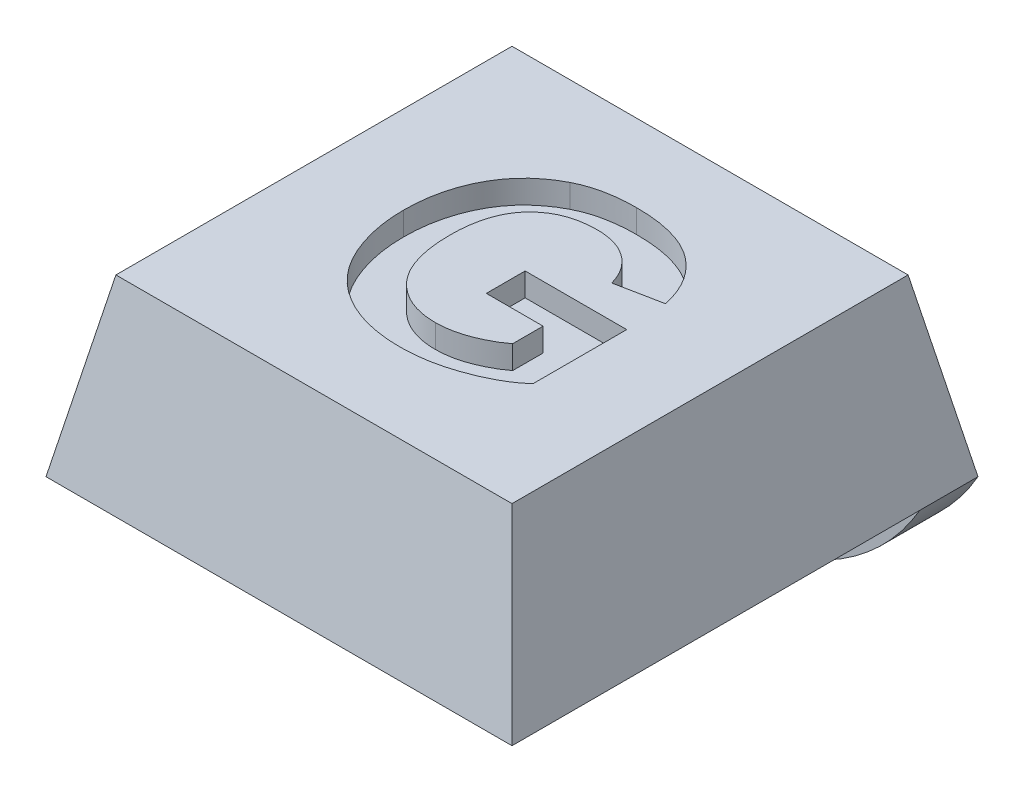
from build123d import *

# Parameters (mm, degrees)
SKETCH1_W               = 8
SKETCH1_H               = 8
BOSS_EXTRUDE1_DEPTH     = 3
CUT_EXTRUDE1_DEPTH      = 12.704699911
CUT_EXTRUDE1_DEPTH_BACK = 12.704699911
CUT_EXTRUDE2_DEPTH      = 11
SKETCH4_R               = 1.8
CUT_EXTRUDE3_DEPTH      = 0.8
SKETCH5_W               = 8
SKETCH5_H               = 1
BOSS_EXTRUDE2_DEPTH     = 2
FILLET1_R               = 4
CUT_EXTRUDE4_DEPTH      = 0.4


with BuildPart() as part:
    # Sketch1 → Boss-Extrude1 (new body)
    with BuildSketch(Plane(origin=(0, 0, 0), x_dir=(1, 0, 0), z_dir=(0, 1, 0))):
        with Locations((4, 4)):
            Rectangle(SKETCH1_W, SKETCH1_H)
    extrude(amount=BOSS_EXTRUDE1_DEPTH)

    # Sketch2 → Cut-Extrude1 (cut, two sides: drawn at the far end of the back side and taken through both)
    with BuildSketch(Plane.XY.offset(-CUT_EXTRUDE1_DEPTH_BACK)):
        Polygon((0, 0), (0.6, 3), (0, 3), align=None)
        Polygon((8, 0), (7.4, 3), (8, 3), align=None)
    extrude(amount=CUT_EXTRUDE1_DEPTH + CUT_EXTRUDE1_DEPTH_BACK, mode=Mode.SUBTRACT)

    # Sketch3 → Cut-Extrude2 (cut)
    with BuildSketch(Plane(origin=(0, 0, 0), x_dir=(0, 0, -1), z_dir=(1, 0, 0))):
        Polygon((0, 0), (0.6, 3), (0, 3), align=None)
        Polygon((8, 3), (7.4, 3), (8, 0), align=None)
    extrude(amount=CUT_EXTRUDE2_DEPTH, mode=Mode.SUBTRACT)

    # Sketch4 → Cut-Extrude3 (cut)
    with BuildSketch(Plane.XZ):
        with Locations(Location((4, -3.75, 0), (0, 0, 270))):
            Circle(SKETCH4_R)
    extrude(amount=-CUT_EXTRUDE3_DEPTH, mode=Mode.SUBTRACT)

    # Sketch5 → Boss-Extrude2 (add)
    with BuildSketch(Plane.XZ):
        with Locations((4, -7.5)):
            Rectangle(SKETCH5_W, SKETCH5_H)
    extrude(amount=BOSS_EXTRUDE2_DEPTH)

    # Fillet1
    # the kernel refuses this fillet: 4 mm, written as the material it takes off along each edge
    with BuildSketch(Plane(origin=(8, -2, -16.660254038), x_dir=(0, 1, 0), z_dir=(0, 0, 1)), Plane(origin=(0, -2, 1.660254038), x_dir=(0, 1, 0), z_dir=(0, 0, -1))) as fillet1_piece_1:
        with BuildLine():
            CenterArc((4, 3.464101615), FILLET1_R, 180, 60)
            Line((0, 3.464101615), (-0.08, 3.464101615))
            Line((-0.08, 3.464101615), (-0.08, 0))
            Line((-0.08, 0), (0, -0.08))
            ThreePointArc((0, -0.08), (1, -0.08), (1.96, -0.069282032))
            Line((1.96, -0.069282032), (2, 0))
        make_face()
    extrude(amount=18.320508076, mode=Mode.SUBTRACT)

    # Sketch6 → Cut-Extrude4 (cut)
    with BuildSketch(Plane(origin=(0, 3, 0), x_dir=(1, 0, 0), z_dir=(0, 1, 0))):
        with BuildLine():
            Line((4.053794593, 3.505457585), (4.053794593, 4.172124252))
            Line((4.053794593, 4.172124252), (5.797384337, 4.172124252))
            Line((5.797384337, 4.172124252), (5.797384337, 2.564752457))
            add(Edge.make_bspline(
                [(5.797384337, 2.564752457), (5.775440275, 2.544992361), (5.730582172, 2.504598726), (5.657391115, 2.447633596), (5.576814656, 2.393249062), (5.489339896, 2.340343698), (5.394785806, 2.289343315), (5.293529517, 2.239537607), (5.185384208, 2.19141366), (5.032450931, 2.131128575), (4.835594452, 2.065533422), (4.594933471, 2.008496304), (4.352368706, 1.973513189), (4.190125473, 1.969167013), (4.109083055, 1.966996047)],
                knots=[0, 0, 0, 0, 0.581799769, 1.189316438, 1.825828404, 2.496525428, 3.203088405, 3.942228803, 4.719818701, 5.534979611, 7.181138583, 8.803804008, 10.403462225, 12, 12, 12, 12], degree=3))
            add(Edge.make_bspline(
                [(4.109083055, 1.966996047), (4.058312627, 1.967758979), (3.958229013, 1.969262944), (3.810482794, 1.981368296), (3.667847904, 2.002080495), (3.530208107, 2.031409962), (3.397097502, 2.066765974), (3.26907094, 2.111868039), (3.146582956, 2.166009466), (3.028523806, 2.226338905), (2.917094396, 2.295632176), (2.812187083, 2.371432832), (2.714561168, 2.454400196), (2.624566637, 2.544701507), (2.540998329, 2.641714843), (2.464831298, 2.745902822), (2.396526155, 2.857385727), (2.335239765, 2.974765127), (2.280716867, 3.097008702), (2.234709094, 3.223154334), (2.194374003, 3.351370526), (2.161222966, 3.482107416), (2.136875151, 3.615790052), (2.117947657, 3.751799892), (2.107781758, 3.890986734), (2.105984472, 3.984609884), (2.105076645, 4.031899893)],
                knots=[0, 0, 0, 0, 1.124918047, 2.217548049, 3.282233239, 4.316494221, 5.334437038, 6.332151046, 7.320712088, 8.300141923, 9.267552434, 10.225301062, 11.165776911, 12.103230934, 13.047553934, 14.000517593, 14.959782875, 15.941944936, 16.932894943, 17.923491392, 18.915624898, 19.910402922, 20.909870877, 21.92519501, 22.95199481, 24, 24, 24, 24], degree=3))
            add(Edge.make_bspline(
                [(2.105076645, 4.031899893), (2.105812881, 4.082940857), (2.107264322, 4.183564655), (2.119773705, 4.33228546), (2.139199297, 4.476648194), (2.168656936, 4.616390773), (2.20449512, 4.75216369), (2.248233589, 4.883877531), (2.301822866, 5.010556427), (2.361436063, 5.133283761), (2.429297714, 5.250362339), (2.505977563, 5.360290437), (2.589206445, 5.464176802), (2.680629029, 5.560371285), (2.779923369, 5.648827012), (2.886080088, 5.730522243), (2.998844963, 5.806865303), (3.079553832, 5.849911113), (3.120301004, 5.871643482)],
                knots=[0, 0, 0, 0, 1.105010302, 2.178452875, 3.229459892, 4.257086284, 5.268538906, 6.268935615, 7.259234261, 8.24469117, 9.221745683, 10.185929258, 11.144249683, 12.101504986, 13.055838221, 14.020611351, 15.000673771, 16, 16, 16, 16], degree=3))
            add(Edge.make_bspline(
                [(3.120301004, 5.871643482), (3.152638085, 5.887700047), (3.218317351, 5.920312247), (3.322813337, 5.959248923), (3.432101667, 5.994677516), (3.547832356, 6.021111591), (3.6692195, 6.042829226), (3.796209305, 6.059036287), (3.929210312, 6.067547239), (4.019595582, 6.068879104), (4.065813824, 6.069560149)],
                knots=[0, 0, 0, 0, 0.887969848, 1.803539625, 2.741143579, 3.713741423, 4.722068772, 5.775476617, 6.8624965, 8, 8, 8, 8], degree=3))
            add(Edge.make_bspline(
                [(4.065813824, 6.069560149), (4.125403824, 6.06867255), (4.241295356, 6.066946335), (4.410256532, 6.05256252), (4.569271079, 6.027772487), (4.718560435, 5.993629866), (4.857802985, 5.949731518), (4.986759025, 5.895763799), (5.106220057, 5.832812796), (5.214455834, 5.758355608), (5.313666102, 5.676257846), (5.403591975, 5.586419647), (5.48426965, 5.488707943), (5.555752499, 5.383614392), (5.617477906, 5.2707046), (5.670549966, 5.151008328), (5.714234697, 5.023616882), (5.73534656, 4.935145779), (5.746102286, 4.89007297)],
                knots=[0, 0, 0, 0, 1.271135529, 2.472123572, 3.614091059, 4.701890498, 5.736279567, 6.724681829, 7.680621489, 8.611506429, 9.52200816, 10.424540711, 11.318996785, 12.221421405, 13.131851814, 14.060431888, 15.011860567, 16, 16, 16, 16], degree=3))
            Line((5.746102286, 4.89007297), (4.976871517, 4.736226816))
            add(Edge.make_bspline(
                [(4.976871517, 4.736226816), (4.969254672, 4.761468809), (4.95422678, 4.81127079), (4.925094227, 4.882758251), (4.891539922, 4.949961192), (4.853483379, 5.013366036), (4.810541206, 5.072582433), (4.761675926, 5.126971617), (4.709961453, 5.179014495), (4.652020351, 5.225088646), (4.590259767, 5.266624284), (4.52537561, 5.304078684), (4.455901775, 5.334453158), (4.382811411, 5.358892727), (4.306461756, 5.37964837), (4.225856415, 5.392413169), (4.141900573, 5.402040295), (4.084540473, 5.402606041), (4.055397158, 5.402893482)],
                knots=[0, 0, 0, 0, 1.027736275, 2.027704492, 3.005900071, 3.954421694, 4.908588141, 5.853155543, 6.803277083, 7.766271258, 8.734041521, 9.704274878, 10.683578894, 11.68490234, 12.708089448, 13.76461009, 14.864251086, 16, 16, 16, 16], degree=3))
            add(Edge.make_bspline(
                [(4.055397158, 5.402893482), (4.01128773, 5.401716629), (3.925204424, 5.399419898), (3.799534269, 5.384433236), (3.680976007, 5.357770589), (3.569219615, 5.320994553), (3.46406021, 5.273789934), (3.366918824, 5.2143961), (3.275376693, 5.146327474), (3.192038786, 5.066438045), (3.116460773, 4.976859168), (3.051034483, 4.876522357), (2.996567377, 4.765751945), (2.951955713, 4.645104141), (2.91643531, 4.514573915), (2.892338718, 4.373699188), (2.876594443, 4.222696077), (2.875085403, 4.118480819), (2.874307414, 4.064752457)],
                knots=[0, 0, 0, 0, 1.043810997, 2.037086103, 2.989314757, 3.91471467, 4.817033861, 5.710208705, 6.603920097, 7.511448416, 8.435617211, 9.371747005, 10.338444094, 11.350425613, 12.411431869, 13.5347293, 14.729025275, 16, 16, 16, 16], degree=3))
            add(Edge.make_bspline(
                [(2.874307414, 4.064752457), (2.875118698, 4.00702506), (2.876695474, 3.894828493), (2.892027057, 3.732262921), (2.917247643, 3.580803592), (2.95342224, 3.44064155), (2.998941149, 3.311279521), (3.053656914, 3.192304252), (3.121182779, 3.085923464), (3.197244894, 2.990004781), (3.28225913, 2.906191636), (3.37384152, 2.833121051), (3.471482188, 2.77119638), (3.576081527, 2.721395085), (3.686320303, 2.681751972), (3.80321198, 2.653959398), (3.926408504, 2.636695674), (4.010734238, 2.634687946), (4.053794593, 2.633662713)],
                knots=[0, 0, 0, 0, 1.318042826, 2.561693173, 3.724929596, 4.821196409, 5.862977565, 6.853497791, 7.804600806, 8.73339865, 9.643480846, 10.524649628, 11.404635349, 12.277659519, 13.165160235, 14.075017549, 15.017020959, 16, 16, 16, 16], degree=3))
            add(Edge.make_bspline(
                [(4.053794593, 2.633662713), (4.097408334, 2.634875039), (4.185053042, 2.637311287), (4.316328539, 2.657956024), (4.448117665, 2.68833542), (4.577327471, 2.734163302), (4.70281192, 2.786727561), (4.819965055, 2.847306941), (4.929675356, 2.910453005), (4.995733738, 2.959668979), (5.028153568, 2.98382297)],
                knots=[0, 0, 0, 0, 0.993821502, 1.997150276, 3.023717651, 4.073291794, 5.118404464, 6.123376694, 7.078999408, 8, 8, 8, 8], degree=3))
            Line((5.028153568, 2.98382297), (5.028153568, 3.505457585))
            Line((5.028153568, 3.505457585), (4.053794593, 3.505457585))
        make_face()
    extrude(amount=-CUT_EXTRUDE4_DEPTH, mode=Mode.SUBTRACT)


solid = part.part
